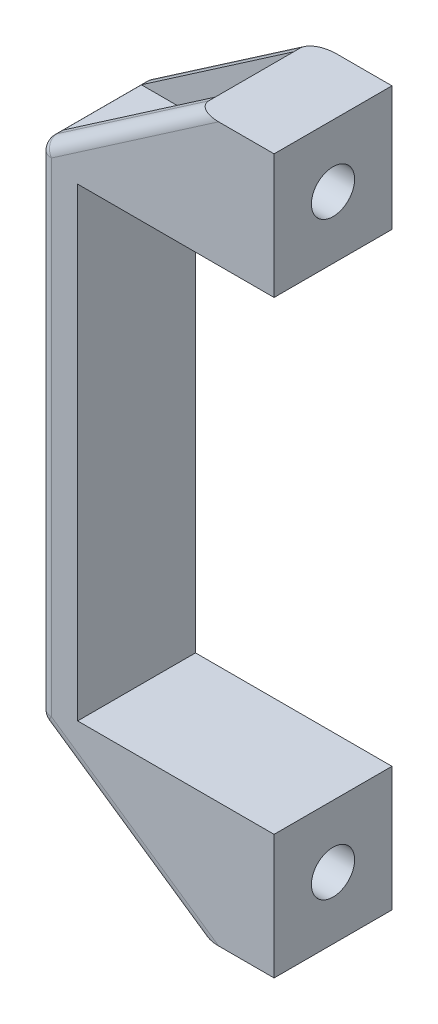
from build123d import *

# Parameters (mm, degrees)
EXTRUDE_1_DEPTH               = 9
SKETCH_2_W                    = 12
SKETCH_2_H                    = 16
CUT_EXTRUDE_1_DEPTH           = 24
HOLE_WIZARD_4_8_1_D           = 6.6
HOLE_WIZARD_4_8_1_CBORE_D     = 11
HOLE_WIZARD_4_8_1_CBORE_DEPTH = 4.7
FILLET_1_R                    = 2


with BuildPart() as part:
    # 草图1 → 凸台-拉伸1 (new, symmetric)
    with BuildSketch(Plane.XY):
        Polygon((0, 0), (-12, 0), (-36, 16.5), (-36, 92.5), (-12, 109), (0, 109), (0, 90), (-30, 90), (-30, 19), (0, 19), align=None)
    extrude(amount=EXTRUDE_1_DEPTH, both=True)

    # 草图2 → 切除-拉伸1 (cut)
    with BuildSketch(Plane.ZY.offset(36)):
        with Locations((0, 101)):
            Rectangle(SKETCH_2_W, SKETCH_2_H)
    cut_extrude_1 = extrude(amount=-CUT_EXTRUDE_1_DEPTH, mode=Mode.SUBTRACT)

    # 打孔尺寸根据内六角花形圆柱头螺钉-4.8级的类型1 (through all)
    with Locations(Plane.ZY.offset(12)):
        with Locations((0, 99.5)):
            hole_wizard_4_8_1 = CounterBoreHole(HOLE_WIZARD_4_8_1_D / 2, HOLE_WIZARD_4_8_1_CBORE_D / 2, HOLE_WIZARD_4_8_1_CBORE_DEPTH)

    # 镜向1: 切除-拉伸1, 打孔尺寸根据内六角花形圆柱头螺钉-4.8级的类型1 across plane
    add(cut_extrude_1.mirror(Plane.ZX.offset(54.5)), mode=Mode.SUBTRACT)
    add(hole_wizard_4_8_1.mirror(Plane.ZX.offset(54.5)), mode=Mode.SUBTRACT)

    # 圆角1
    # the kernel refuses this fillet: 2 mm, written as the material it takes off along each edge
    with BuildSketch(Plane(origin=(-34, 91.44793902, -7), x_dir=(-1, 0, 0), z_dir=(0, 0, -1))) as fillet_1_piece_1_section:
        Polygon((0, 0), (FILLET_1_R, 0), (FILLET_1_R, FILLET_1_R * 0.526030489934), (FILLET_1_R * 0.566528822887, FILLET_1_R * 0.824041924199), align=None)
    fillet_1_piece_1 = extrude(amount=FILLET_1_R, mode=Mode.PRIVATE)
    fillet_1_piece_1 = fillet_1_piece_1 - Plane(origin=(-34, 91.44793902, -7), x_dir=(0.8850222660721778, -0.46554869622464556, 0), z_dir=(0, 0, -1)) * Sphere(FILLET_1_R, mode=Mode.PRIVATE)
    add(fillet_1_piece_1, mode=Mode.SUBTRACT)
    with BuildSketch(Plane(origin=(-34, 91.44793902, 7), x_dir=(-1, 0, 0), z_dir=(0, 0, 1))) as fillet_1_piece_2_section:
        Polygon((0, 0), (FILLET_1_R, 0), (FILLET_1_R, -FILLET_1_R * 0.526030489934), (FILLET_1_R * 0.566528822887, -FILLET_1_R * 0.824041924199), align=None)
    fillet_1_piece_2 = extrude(amount=FILLET_1_R, mode=Mode.PRIVATE)
    fillet_1_piece_2 = fillet_1_piece_2 - Plane(origin=(-34, 91.44793902, 7), x_dir=(0.8850222660721778, -0.46554869622464556, 0), z_dir=(0, 0, 1)) * Sphere(FILLET_1_R, mode=Mode.PRIVATE)
    add(fillet_1_piece_2, mode=Mode.SUBTRACT)
    with BuildSketch(Plane(origin=(-34, 17.55206098, 7), x_dir=(-1, 0, 0), z_dir=(0, 0, 1))) as fillet_1_piece_3_section:
        Polygon((0, 0), (FILLET_1_R, 0), (FILLET_1_R, FILLET_1_R * 0.526030489934), (FILLET_1_R * 0.566528822887, FILLET_1_R * 0.824041924199), align=None)
    fillet_1_piece_3 = extrude(amount=FILLET_1_R, mode=Mode.PRIVATE)
    fillet_1_piece_3 = fillet_1_piece_3 - Plane(origin=(-34, 17.55206098, 7), x_dir=(0.8850222660721778, 0.46554869622464556, 0), z_dir=(0, 0, 1)) * Sphere(FILLET_1_R, mode=Mode.PRIVATE)
    add(fillet_1_piece_3, mode=Mode.SUBTRACT)
    with BuildSketch(Plane(origin=(-34, 17.55206098, -7), x_dir=(-0.5665288228870655, -0.8240419241993675, 0), z_dir=(0, 0, -1))) as fillet_1_piece_4_section:
        Polygon((0, 0), (FILLET_1_R, 0), (FILLET_1_R, FILLET_1_R * 0.526030489934), (FILLET_1_R * 0.566528822887, FILLET_1_R * 0.824041924199), align=None)
    fillet_1_piece_4 = extrude(amount=FILLET_1_R, mode=Mode.PRIVATE)
    fillet_1_piece_4 = fillet_1_piece_4 - Plane(origin=(-34, 17.55206098, -7), x_dir=(0.8850222660721778, 0.46554869622464556, 0), z_dir=(0, 0, -1)) * Sphere(FILLET_1_R, mode=Mode.PRIVATE)
    add(fillet_1_piece_4, mode=Mode.SUBTRACT)
    with BuildSketch(Plane(origin=(-35.133057646, 93.096022869, -9), x_dir=(0.5665288228870655, -0.8240419241993674, 0), z_dir=(0.8240419241993675, 0.5665288228870655, 0)), Plane(origin=(-7.879790379, -2.832644114, 9), x_dir=(0, 0, -1), z_dir=(-0.8240419241993675, 0.5665288228870655, 0)), Plane(origin=(-7.879790379, -2.832644114, -9), x_dir=(0.5665288228870655, 0.8240419241993675, 0), z_dir=(-0.8240419241993675, 0.5665288228870655, 0))) as fillet_1_piece_5:
        with BuildLine():
            CenterArc((FILLET_1_R, -FILLET_1_R), FILLET_1_R, 90, 90)
            Line((0, -FILLET_1_R), (0, 0))
            Line((0, 0), (FILLET_1_R, 0))
        make_face()
    extrude(amount=33.072670779, mode=Mode.SUBTRACT)
    with BuildSketch(Plane(origin=(-35.133057646, 93.096022869, 9), x_dir=(0.5665288228870655, -0.8240419241993674, 0), z_dir=(0.8240419241993675, 0.5665288228870655, 0))) as fillet_1_piece_6:
        with BuildLine():
            CenterArc((FILLET_1_R, FILLET_1_R), FILLET_1_R, 180, 90)
            Line((0, FILLET_1_R), (0, 0))
            Line((0, 0), (FILLET_1_R, 0))
        make_face()
    extrude(amount=33.072670779, mode=Mode.SUBTRACT)
    with BuildSketch(Plane(origin=(-36, 92.5, 7), x_dir=(0, -1, 0), z_dir=(0, 0, -1)), Plane(origin=(-36, 16.5, 7), x_dir=(0.8240419241993692, -0.566528822887063, 0), z_dir=(0, 0, -1))) as fillet_1_piece_7:
        with BuildLine():
            CenterArc((FILLET_1_R * 0.526030489934, -FILLET_1_R), FILLET_1_R, 90, 55.491477012)
            Line((-FILLET_1_R * 0.298011434265, -FILLET_1_R * 0.433471177113), (0, 0))
            Line((0, 0), (FILLET_1_R * 0.526030489934, 0))
        make_face()
    extrude(amount=14, mode=Mode.SUBTRACT)
    with BuildSketch(Plane(origin=(-36, 17.55206098, -9), x_dir=(1, 0, 0), z_dir=(0, 1, 0))) as fillet_1_piece_8:
        with BuildLine():
            CenterArc((FILLET_1_R, -FILLET_1_R), FILLET_1_R, 90, 90)
            Line((0, -FILLET_1_R), (0, 0))
            Line((0, 0), (FILLET_1_R, 0))
        make_face()
    extrude(amount=73.89587804, mode=Mode.SUBTRACT)
    with BuildSketch(Plane(origin=(-36, 17.55206098, 9), x_dir=(1, 0, 0), z_dir=(0, 1, 0))) as fillet_1_piece_9:
        with BuildLine():
            CenterArc((FILLET_1_R, FILLET_1_R), FILLET_1_R, 180, 90)
            Line((0, FILLET_1_R), (0, 0))
            Line((0, 0), (FILLET_1_R, 0))
        make_face()
    extrude(amount=73.89587804, mode=Mode.SUBTRACT)


solid = part.part
